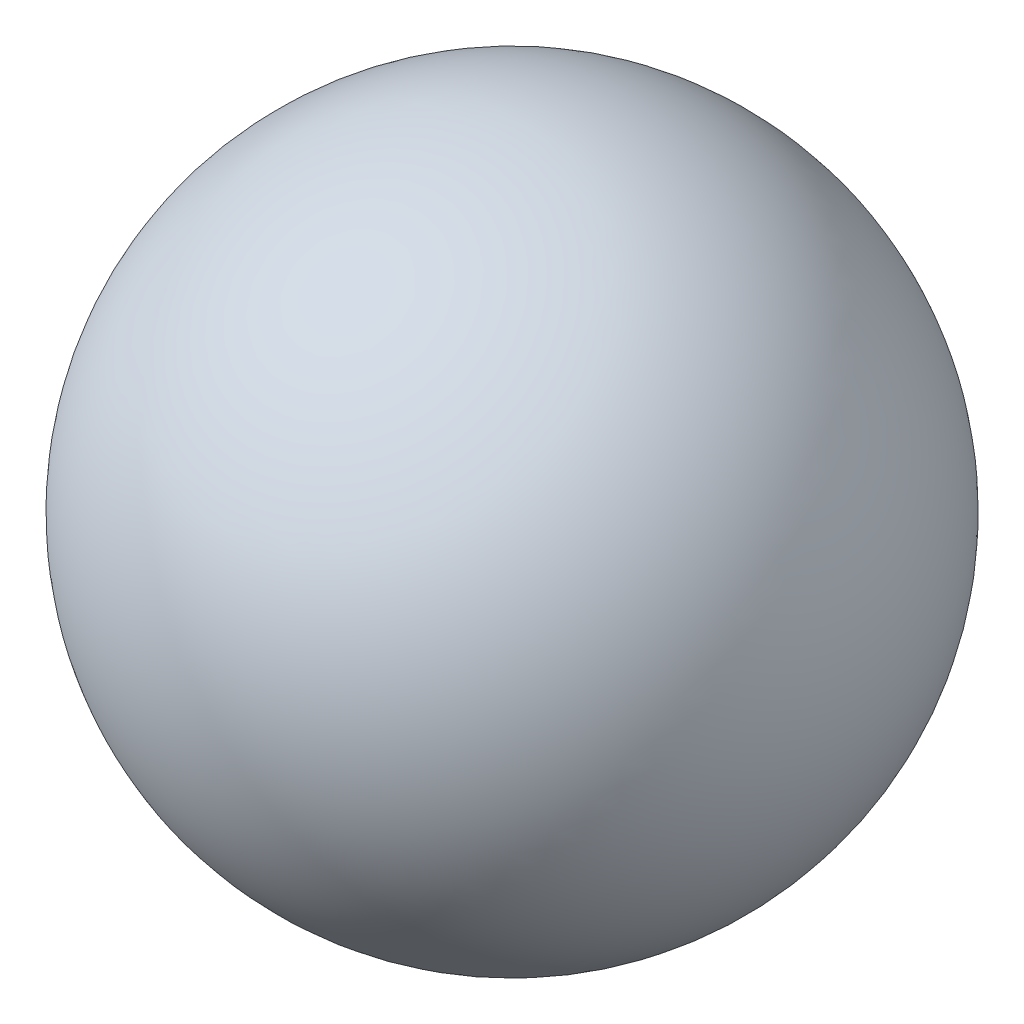
from build123d import *


with BuildPart() as part:
    # Sketch1 → Revolve2 (revolve)
    with BuildSketch(Plane(origin=(0, 0, 0), x_dir=(1, 0, 0), z_dir=(0, 1, 0))):
        with BuildLine():
            Line((0, -3), (0, 3))
            ThreePointArc((0, 3), (3, 0), (0, -3))
        make_face()
    revolve(axis=Axis((0, 0, 717.391470219), (0, 0, -1)))


solid = part.part
